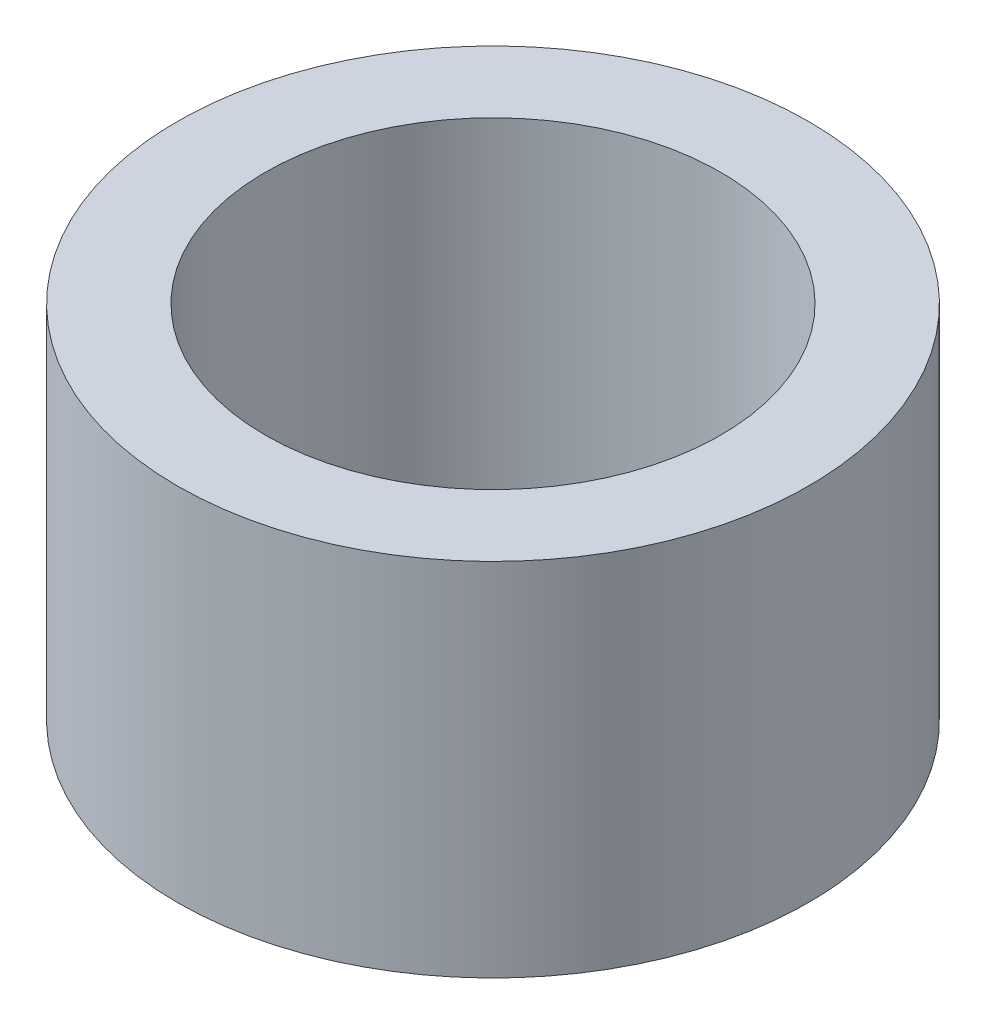
from build123d import *

# Parameters (mm, degrees)
SKETCH1_R           = 3.5
SKETCH1_R_2         = 2.525
BOSS_EXTRUDE1_DEPTH = 4


with BuildPart() as part:
    # Sketch1 → Boss-Extrude1 (new body)
    with BuildSketch(Plane(origin=(0, 0, 0), x_dir=(1, 0, 0), z_dir=(0, 1, 0))):
        Circle(SKETCH1_R)
        Circle(SKETCH1_R_2, mode=Mode.SUBTRACT)
    extrude(amount=BOSS_EXTRUDE1_DEPTH)


solid = part.part
